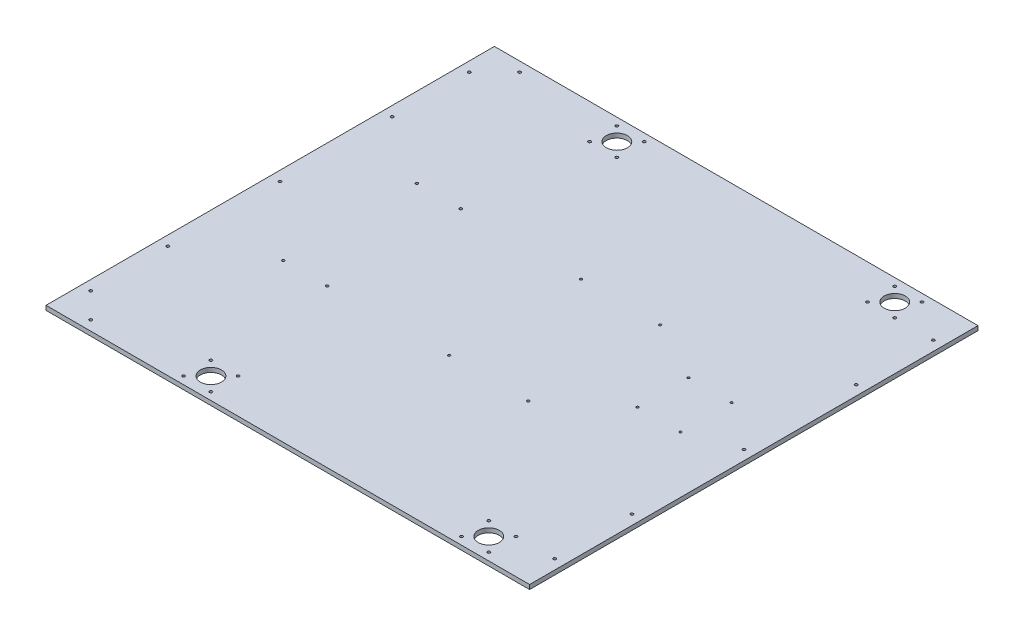
from build123d import *

# Parameters (mm, degrees)
SKETCH1_W                              = 510
SKETCH1_H                              = 5
BOSS_EXTRUDE1_DEPTH                    = 550
BOTTHOMHOLES_SKETCH2_R                 = 12
BOTTHOMHOLES_SKETCH2_R_2               = 1.5875
BOTTOMHOLES_CUT_EXTRUDE1_DEPTH         = 751.083328704
BOTTOMPSUHOLESSKETCH2_R                = 1.5
BOTTOMPSUHOLESCUT_EXTRUDE1_DEPTH       = 751.083328704
BOTTOMMAINBOARDHOLESSKETCH2_R          = 1.35
BOTTOMMAINBOARDHOLESCUT_EXTRUDE1_DEPTH = 751.083328704


with BuildPart() as part:
    # Sketch1 → Boss-Extrude1 (new body)
    with BuildSketch(Plane(origin=(0, 0, 0), x_dir=(0, 0, -1), z_dir=(1, 0, 0))):
        with Locations((-255, 2.5)):
            Rectangle(SKETCH1_W, SKETCH1_H)
    extrude(amount=BOSS_EXTRUDE1_DEPTH)

    # BotthomHoles-Sketch2 → BottomHoles-Cut-Extrude1 (cut, through all)
    with BuildSketch(Plane(origin=(0, 5, 0), x_dir=(1, 0, 0), z_dir=(0, 1, 0))):
        with Locations((479.425, -24.175)):
            Circle(BOTTHOMHOLES_SKETCH2_R)
        with Locations((463.925, -8.675)):
            Circle(BOTTHOMHOLES_SKETCH2_R_2)
        with Locations((494.925, -8.675)):
            Circle(BOTTHOMHOLES_SKETCH2_R_2)
        with Locations((463.925, -39.675)):
            Circle(BOTTHOMHOLES_SKETCH2_R_2)
        with Locations((494.925, -39.675)):
            Circle(BOTTHOMHOLES_SKETCH2_R_2)
        with Locations((39.6875, -11.1125)):
            Circle(BOTTHOMHOLES_SKETCH2_R_2)
        with Locations((178.925, -39.675)):
            Circle(BOTTHOMHOLES_SKETCH2_R_2)
        with Locations((147.925, -39.675)):
            Circle(BOTTHOMHOLES_SKETCH2_R_2)
        with Locations((178.925, -8.675)):
            Circle(BOTTHOMHOLES_SKETCH2_R_2)
        with Locations((147.925, -8.675)):
            Circle(BOTTHOMHOLES_SKETCH2_R_2)
        with Locations((163.425, -24.175)):
            Circle(BOTTHOMHOLES_SKETCH2_R)
        with Locations((39.6875, -498.8875)):
            Circle(BOTTHOMHOLES_SKETCH2_R_2)
        with Locations((147.925, -501.325)):
            Circle(BOTTHOMHOLES_SKETCH2_R_2)
        with Locations((178.925, -501.325)):
            Circle(BOTTHOMHOLES_SKETCH2_R_2)
        with Locations((147.925, -470.325)):
            Circle(BOTTHOMHOLES_SKETCH2_R_2)
        with Locations((178.925, -470.325)):
            Circle(BOTTHOMHOLES_SKETCH2_R_2)
        with Locations((463.925, -470.325)):
            Circle(BOTTHOMHOLES_SKETCH2_R_2)
        with Locations((463.925, -501.325)):
            Circle(BOTTHOMHOLES_SKETCH2_R_2)
        with Locations((494.925, -470.325)):
            Circle(BOTTHOMHOLES_SKETCH2_R_2)
        with Locations((494.925, -501.325)):
            Circle(BOTTHOMHOLES_SKETCH2_R_2)
        with Locations((163.425, -485.825)):
            Circle(BOTTHOMHOLES_SKETCH2_R)
        with Locations((479.425, -485.825)):
            Circle(BOTTHOMHOLES_SKETCH2_R)
        with Locations((11.1125, -39.6875)):
            Circle(BOTTHOMHOLES_SKETCH2_R_2)
        with Locations((11.1125, -127.5)):
            Circle(BOTTHOMHOLES_SKETCH2_R_2)
        with Locations((11.1125, -255)):
            Circle(BOTTHOMHOLES_SKETCH2_R_2)
        with Locations((11.1125, -382.5)):
            Circle(BOTTHOMHOLES_SKETCH2_R_2)
        with Locations((11.1125, -470.3125)):
            Circle(BOTTHOMHOLES_SKETCH2_R_2)
        with Locations((538.8875, -470.3125)):
            Circle(BOTTHOMHOLES_SKETCH2_R_2)
        with Locations((538.8875, -382.5)):
            Circle(BOTTHOMHOLES_SKETCH2_R_2)
        with Locations((538.8875, -255)):
            Circle(BOTTHOMHOLES_SKETCH2_R_2)
        with Locations((538.8875, -127.5)):
            Circle(BOTTHOMHOLES_SKETCH2_R_2)
        with Locations((538.8875, -39.6875)):
            Circle(BOTTHOMHOLES_SKETCH2_R_2)
    extrude(amount=-BOTTOMHOLES_CUT_EXTRUDE1_DEPTH, mode=Mode.SUBTRACT)

    # BottomPSUHolesSketch2 → BottomPSUHolesCut-Extrude1 (cut, through all)
    with BuildSketch(Plane(origin=(0, 5, 0), x_dir=(1, 0, 0), z_dir=(0, 1, 0))):
        with Locations((90.8, -179)):
            Circle(BOTTOMPSUHOLESSKETCH2_R)
        with Locations((140.8, -179)):
            Circle(BOTTOMPSUHOLESSKETCH2_R)
        with Locations((90.8, -331)):
            Circle(BOTTOMPSUHOLESSKETCH2_R)
        with Locations((140.8, -331)):
            Circle(BOTTOMPSUHOLESSKETCH2_R)
    extrude(amount=-BOTTOMPSUHOLESCUT_EXTRUDE1_DEPTH, mode=Mode.SUBTRACT)

    # BottomMainboardHolesSketch2 → BottomMainboardHolesCut-Extrude1 (cut, through all)
    with BuildSketch(Plane(origin=(0, 5, 0), x_dir=(1, 0, 0), z_dir=(0, 1, 0))):
        with Locations((278.5, -180)):
            Circle(BOTTOMMAINBOARDHOLESSKETCH2_R)
        with Locations((368.5, -180)):
            Circle(BOTTOMMAINBOARDHOLESSKETCH2_R)
        with Locations((278.5, -330)):
            Circle(BOTTOMMAINBOARDHOLESSKETCH2_R)
        with Locations((368.5, -330)):
            Circle(BOTTOMMAINBOARDHOLESSKETCH2_R)
        with Locations((436.7, -216)):
            Circle(BOTTOMMAINBOARDHOLESSKETCH2_R)
        with Locations((485.7, -216)):
            Circle(BOTTOMMAINBOARDHOLESSKETCH2_R)
        with Locations((436.7, -274)):
            Circle(BOTTOMMAINBOARDHOLESSKETCH2_R)
        with Locations((485.7, -274)):
            Circle(BOTTOMMAINBOARDHOLESSKETCH2_R)
    extrude(amount=-BOTTOMMAINBOARDHOLESCUT_EXTRUDE1_DEPTH, mode=Mode.SUBTRACT)


solid = part.part
